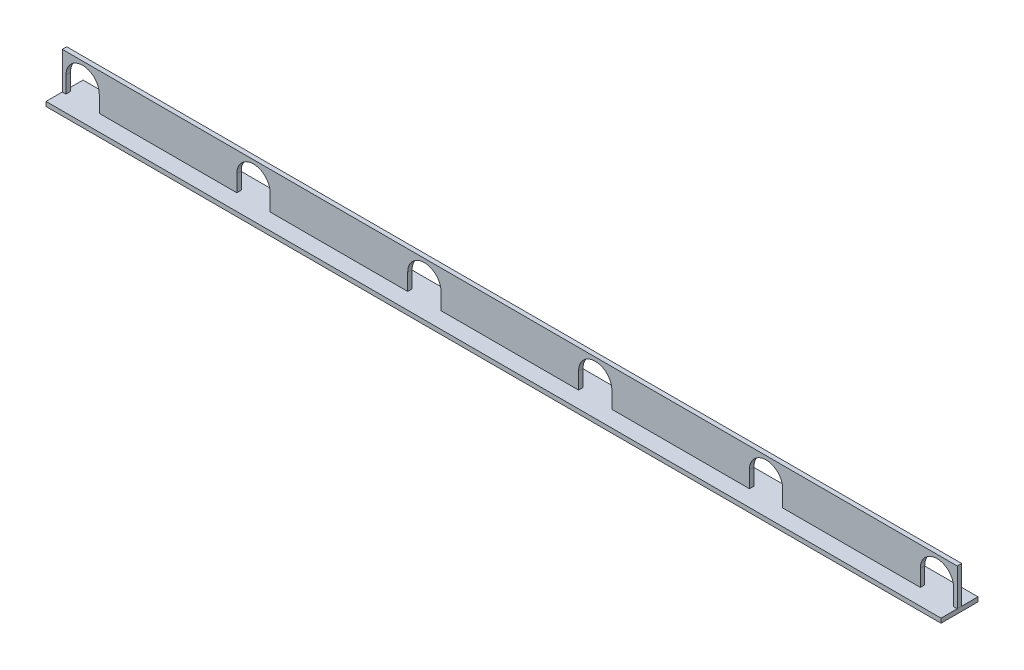
from build123d import *

# Parameters (mm, degrees)
EXTRUDE_1_DEPTH = 3
SKETCH_2_W      = 1210
SKETCH_2_H      = 50
EXTRUDE_2_DEPTH = 6


with BuildPart() as part:
    # Эскиз1 → Бобышка-Вытянуть1 (new, symmetric)
    with BuildSketch(Plane.XY):
        with BuildLine():
            Line((-600, -2.5), (-600, -25))
            Line((-600, -25), (-605, -25))
            Line((-605, -25), (-605, 25))
            Line((-605, 25), (605, 25))
            Line((605, 25), (605, -25))
            Line((605, -25), (600, -25))
            Line((600, -25), (600, -2.5))
            ThreePointArc((600, -2.5), (577.5, 20), (555, -2.5))
            Line((555, -2.5), (555, -25))
            Line((555, -25), (369, -25))
            Line((369, -25), (369, -2.5))
            ThreePointArc((369, -2.5), (346.5, 20), (324, -2.5))
            Line((324, -2.5), (324, -25))
            Line((324, -25), (138, -25))
            Line((138, -25), (138, -2.5))
            ThreePointArc((138, -2.5), (115.5, 20), (93, -2.5))
            Line((93, -2.5), (93, -25))
            Line((93, -25), (-93, -25))
            Line((-93, -25), (-93, -2.5))
            ThreePointArc((-93, -2.5), (-115.5, 20), (-138, -2.5))
            Line((-138, -2.5), (-138, -25))
            Line((-138, -25), (-324, -25))
            Line((-324, -25), (-324, -2.5))
            ThreePointArc((-324, -2.5), (-346.5, 20), (-369, -2.5))
            Line((-369, -2.5), (-369, -25))
            Line((-369, -25), (-555, -25))
            Line((-555, -25), (-555, -2.5))
            ThreePointArc((-555, -2.5), (-577.5, 20), (-600, -2.5))
        make_face()
    extrude(amount=EXTRUDE_1_DEPTH, both=True)


with BuildPart() as body_2:
    # Эскиз2 → Бобышка-Вытянуть2 (new body)
    with BuildSketch(Plane.XZ.offset(25)):
        Rectangle(SKETCH_2_W, SKETCH_2_H)
    extrude(amount=EXTRUDE_2_DEPTH)


solid = Compound([part.part, body_2.part])
